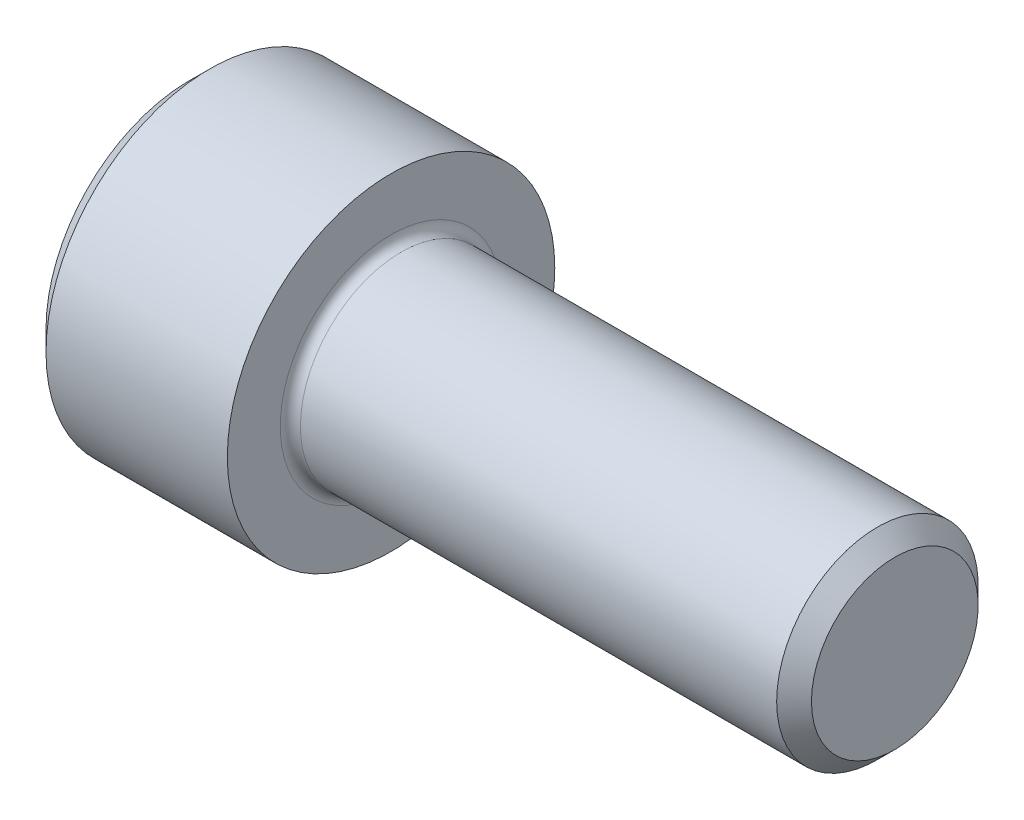
from build123d import *

# Parameters (mm, degrees)
FILLET1_R = 0.4


with BuildPart() as part:
    # BodySke → Base-Revolve (revolve)
    with BuildSketch(Plane.XY):
        Polygon((0, 0), (0, 5.7), (0.8, 6.5), (8, 6.5), (8, 4), (27.3095, 4), (28, 3.3095), (28, 0), align=None)
    revolve(axis=Axis((-31.75, 0, 0), (1, 0, 0)))

    # Fillet1
    fillet1_edges = [part.edges().sort_by_distance(p)[0] for p in [
        (8, -4, 0),
    ]]
    fillet(fillet1_edges, radius=FILLET1_R)


solid = part.part
